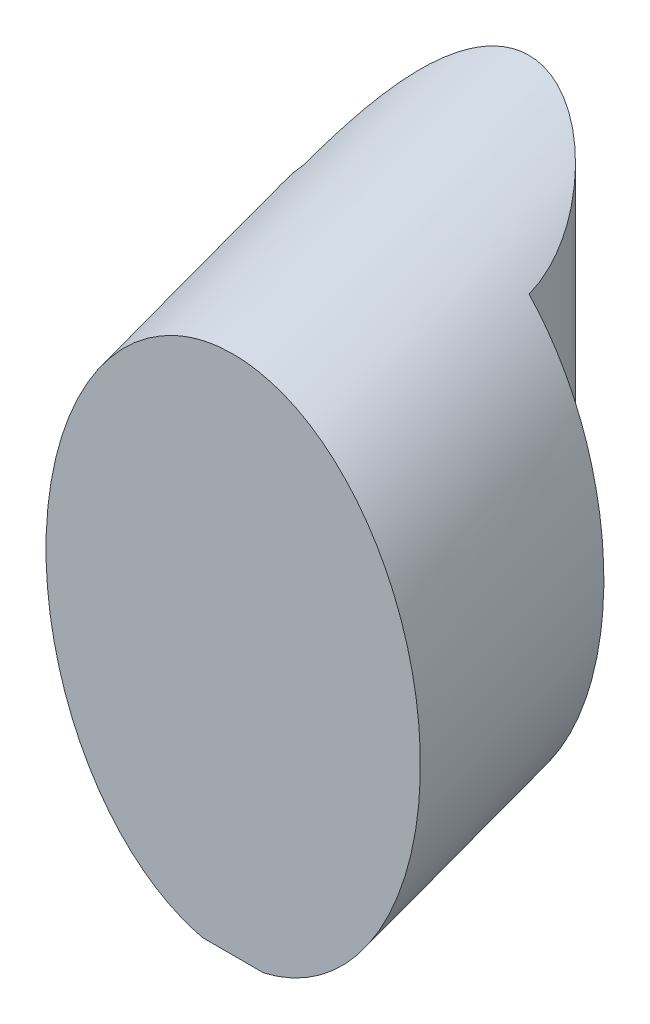
from build123d import *

# Parameters (mm, degrees)
CUT_EXTRUDE1_DEPTH      = 2.374772876
CUT_EXTRUDE1_DEPTH_BACK = 2.374772876
CUT_EXTRUDE2_START      = -0.483063467
CUT_EXTRUDE2_DEPTH      = 0.146813467


# Read off the part's stored shape, not the designer's step: Cut-Extrude2
with BuildPart() as part:
    # Sweep1: sweep along a path in Sketch3
    with BuildLine(Plane(origin=(0, 0, 0), x_dir=(0, 0, -1), z_dir=(1, 0, 0))) as sweep1_path:
        Line((0, 0), (0.8, 0.3))
    # Sketch1 → Sweep1 (sweep)
    with BuildSketch(Plane.XY):
        with BuildLine():
            Line((-0.081490966, -0.690640338), (0.081490966, -0.690640338))
            add(Edge.make_bspline(
                [(0.081490966, -0.690640338), (0.837464392, -0.515808659), (0.418732196, 0.382544327), (0, 1.280897313), (-0.418732196, 0.382544327), (-0.837464392, -0.515808659), (-0.081490966, -0.690640338)],
                knots=[3.305304901, 3.305304901, 3.305304901, 5.290558505, 5.290558505, 7.275812109, 7.275812109, 9.261065714, 9.261065714, 9.261065714], degree=2, weights=[1, 0.546491895, 1, 0.546491895, 1, 0.546491895, 1]))
        make_face()
    sweep(path=sweep1_path.line)

    # Sketch5 → Cut-Extrude1 (cut, two sides: drawn at the far end of the back side and taken through both)
    with BuildSketch(Plane(origin=(0, 0, 0), x_dir=(1, 0, 0), z_dir=(0, 1, 0)).offset(-CUT_EXTRUDE1_DEPTH_BACK)):
        with BuildLine():
            Line((-0.5, 0.49), (-0.3, 0.49))
            ThreePointArc((-0.3, 0.49), (0, 0.79), (0.3, 0.49))
            Line((0.3, 0.49), (0.5, 0.49))
            Line((0.5, 0.49), (0.5, 0.8))
            Line((0.5, 0.8), (-0.5, 0.8))
            Line((-0.5, 0.8), (-0.5, 0.49))
        make_face()
    extrude(amount=CUT_EXTRUDE1_DEPTH + CUT_EXTRUDE1_DEPTH_BACK, mode=Mode.SUBTRACT)

    # Cut-Extrude2 outline → Cut-Extrude2 (cut)
    with BuildSketch(Plane(origin=(0, 0, 0), x_dir=(1, 0, 0), z_dir=(0, 1, 0)).offset(CUT_EXTRUDE2_START)):
        with BuildLine():
            ThreePointArc((0.3, 0.49), (0, 0.79), (-0.3, 0.49))
            Line((-0.3, 0.49), (0.3, 0.49))
        make_face()
    extrude(amount=CUT_EXTRUDE2_DEPTH, mode=Mode.SUBTRACT)


solid = part.part
